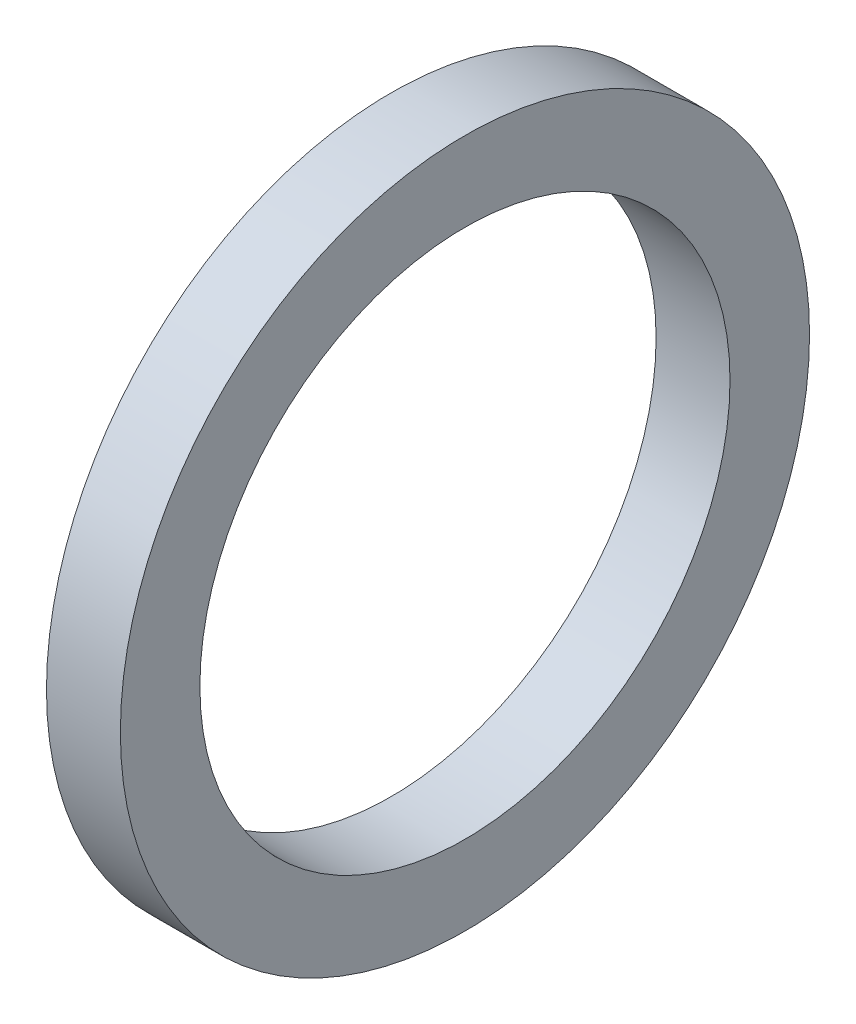
from build123d import *

# Parameters (mm, degrees)
SKETCH3_W = 6.97000003
SKETCH3_H = 7.499999986


with BuildPart() as part:
    # Sketch3 → Revolve1 (revolve)
    with BuildSketch(Plane.XY):
        with Locations((31.315400285, 28.750000031)):
            Rectangle(SKETCH3_W, SKETCH3_H)
    revolve(axis=Axis((0, 0, 0), (1, 0, 0)))


solid = part.part
